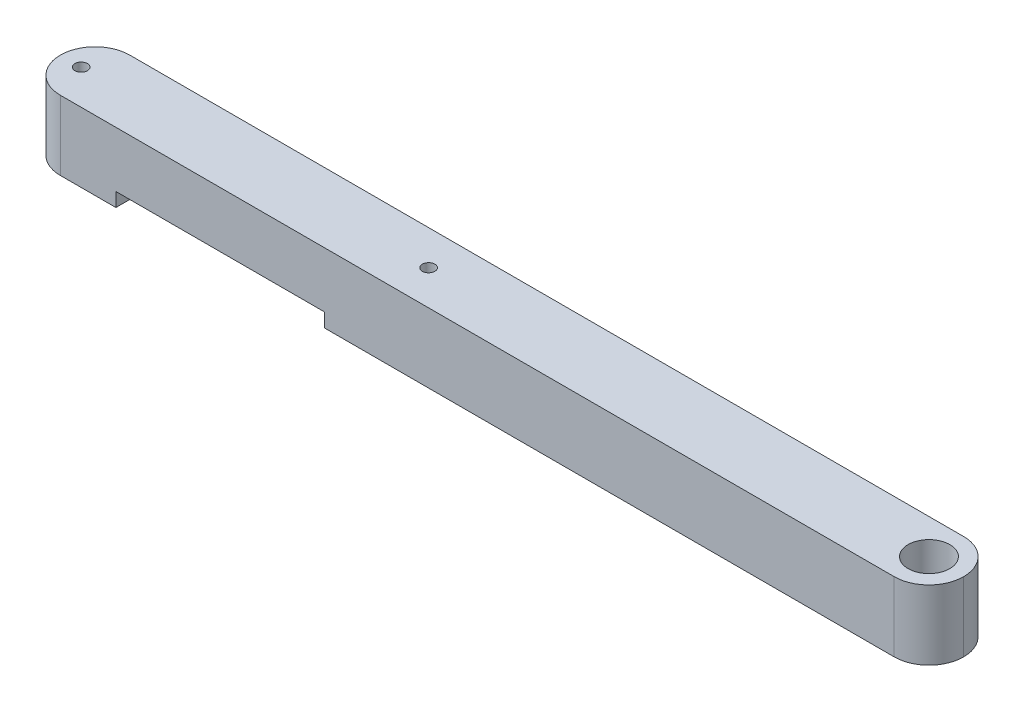
from build123d import *

# Parameters (mm, degrees)
SKETCH1_W               = 130
SKETCH1_H               = 10
SKETCH1_R               = 0.9
SKETCH1_R_2             = 3
BOSS_EXTRUDE1_DEPTH     = 10
CUT_EXTRUDE1_DEPTH      = 131.766968306
CUT_EXTRUDE1_DEPTH_BACK = 131.766968306
SKETCH2_W               = 30
SKETCH2_H               = 2
FILLET1_R               = 5


with BuildPart() as part:
    # Sketch1 → Boss-Extrude1 (new body)
    with BuildSketch(Plane(origin=(0, 0, 0), x_dir=(1, 0, 0), z_dir=(0, 1, 0))):
        with Locations((65, 5)):
            Rectangle(SKETCH1_W, SKETCH1_H)
        with Locations(Location((3, 5, 0), (0, 0, 270))):
            Circle(SKETCH1_R, mode=Mode.SUBTRACT)
        with Locations(Location((53, 5, 0), (0, 0, 270))):
            Circle(SKETCH1_R, mode=Mode.SUBTRACT)
        with Locations(Location((125, 5, 0), (0, 0, 270))):
            Circle(SKETCH1_R_2, mode=Mode.SUBTRACT)
    extrude(amount=BOSS_EXTRUDE1_DEPTH)

    # Sketch2 → Cut-Extrude1 (cut, two sides: drawn at the far end of the back side and taken through both)
    with BuildSketch(Plane.XY.offset(-CUT_EXTRUDE1_DEPTH_BACK)):
        with Locations((28, 1)):
            Rectangle(SKETCH2_W, SKETCH2_H)
    extrude(amount=CUT_EXTRUDE1_DEPTH + CUT_EXTRUDE1_DEPTH_BACK, mode=Mode.SUBTRACT)

    # Fillet1
    fillet1_edges = [part.edges().sort_by_distance(p)[0] for p in [
        (130, 5, 0),
        (130, 5, -10),
        (0, 5, 0),
        (0, 5, -10),
    ]]
    fillet(fillet1_edges, radius=FILLET1_R - 0.0001)  # a hair under: the kernel refuses the full size


solid = part.part
